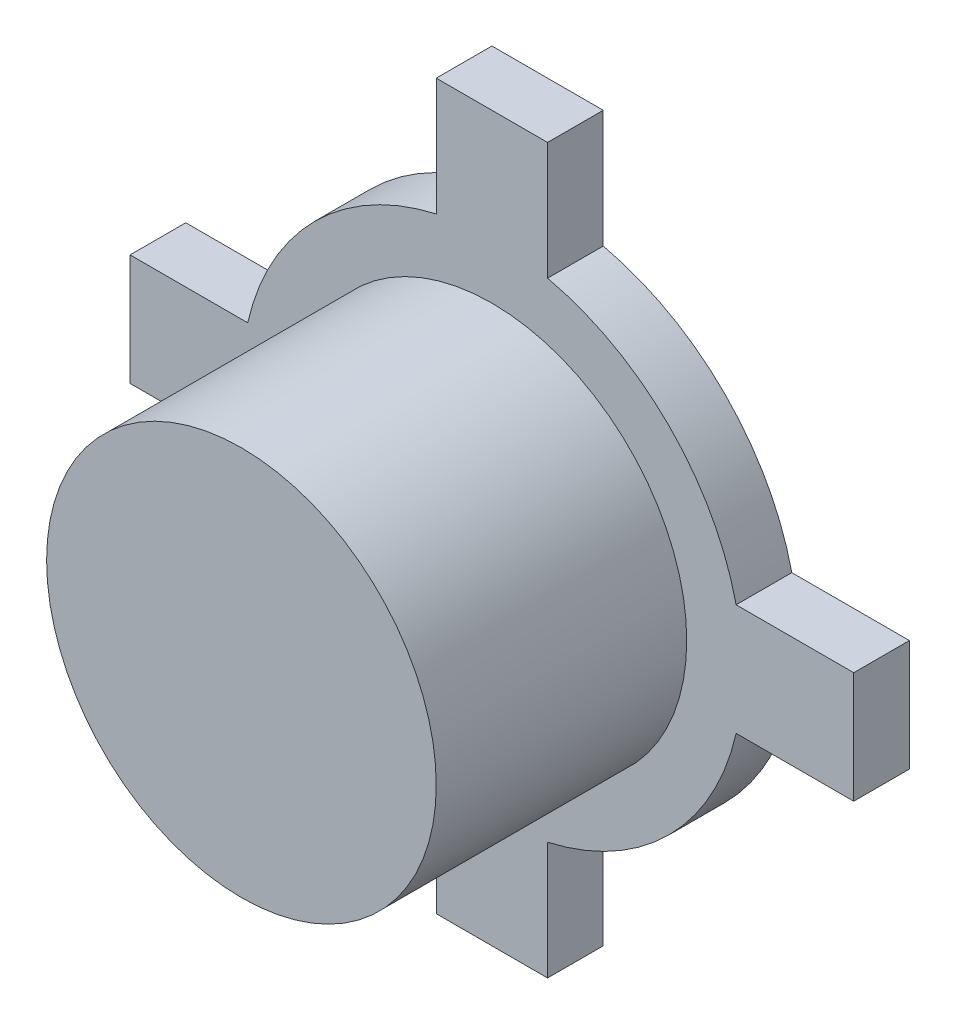
from build123d import *

# Parameters (mm, degrees)
SKETCH1_R           = 3.5
BOSS_EXTRUDE1_DEPTH = 4.5
BOSS_EXTRUDE2_DEPTH = 1


with BuildPart() as part:
    # Sketch1 → Boss-Extrude1 (new body)
    with BuildSketch(Plane.XY):
        Circle(SKETCH1_R)
    extrude(amount=BOSS_EXTRUDE1_DEPTH)

    # Sketch2 → Boss-Extrude2 (add)
    with BuildSketch(Plane(origin=(0, 0, 0), x_dir=(-1, 0, 0), z_dir=(0, 0, -1))):
        with BuildLine():
            Line((-1, 6.5), (-1, 4.387482194))
            ThreePointArc((-1, 4.387482194), (-3.181980515, 3.181980515), (-4.387482194, 1))
            Line((-4.387482194, 1), (-6.5, 1))
            Line((-6.5, 1), (-6.5, -1))
            Line((-6.5, -1), (-4.387482194, -1))
            ThreePointArc((-4.387482194, -1), (-3.181980515, -3.181980515), (-1, -4.387482194))
            Line((-1, -4.387482194), (-1, -6.5))
            Line((-1, -6.5), (1, -6.5))
            Line((1, -6.5), (1, -4.387482194))
            ThreePointArc((1, -4.387482194), (3.181980515, -3.181980515), (4.387482194, -1))
            Line((4.387482194, -1), (6.5, -1))
            Line((6.5, -1), (6.5, 1))
            Line((6.5, 1), (4.387482194, 1))
            ThreePointArc((4.387482194, 1), (3.181980515, 3.181980515), (1, 4.387482194))
            Line((1, 4.387482194), (1, 6.5))
            Line((1, 6.5), (-1, 6.5))
        make_face()
    extrude(amount=BOSS_EXTRUDE2_DEPTH)


solid = part.part
